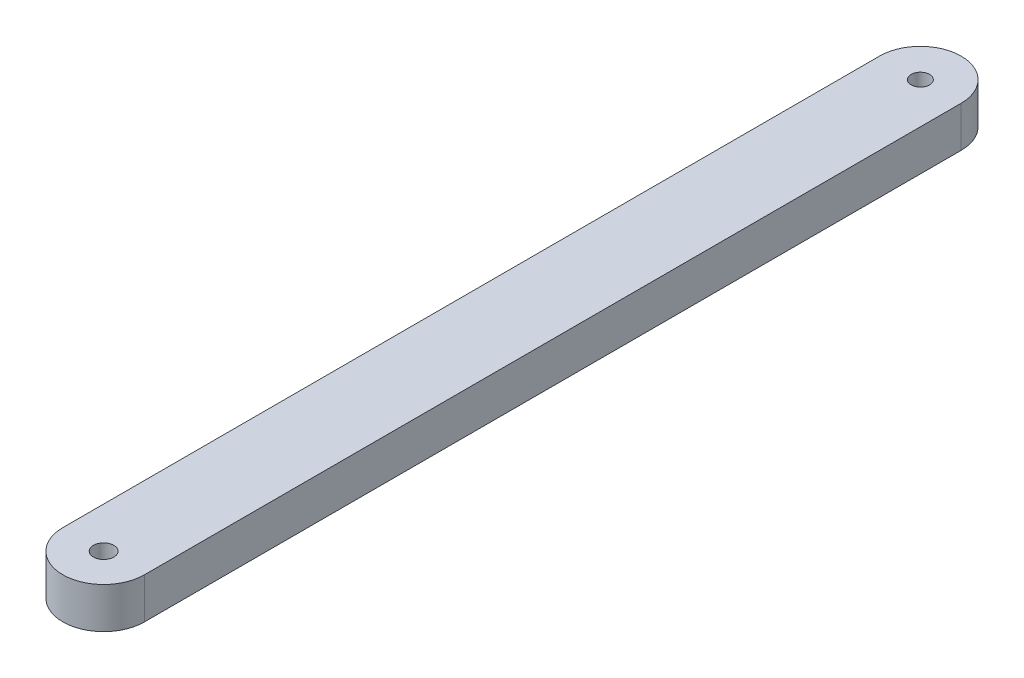
from build123d import *

# Parameters (mm, degrees)
SKETCH1_R           = 2.5
BOSS_EXTRUDE1_DEPTH = 10


with BuildPart() as part:
    # Sketch1 → Boss-Extrude1 (new body)
    with BuildSketch(Plane(origin=(0, 0, 0), x_dir=(1, 0, 0), z_dir=(0, 1, 0))):
        with BuildLine():
            ThreePointArc((-10, -100), (0, -110), (10, -100))
            Line((10, -100), (10, 100))
            ThreePointArc((10, 100), (0, 110), (-10, 100))
            Line((-10, 100), (-10, -100))
        make_face()
        with Locations((0, -100)):
            Circle(SKETCH1_R, mode=Mode.SUBTRACT)
        with BuildLine():
            ThreePointArc((1.5875, 98.4125), (0, 97.75493597), (-1.5875, 98.4125))
            ThreePointArc((-1.5875, 98.4125), (-2.24506403, 100), (-1.5875, 101.5875))
            ThreePointArc((-1.5875, 101.5875), (0, 102.24506403), (1.5875, 101.5875))
            ThreePointArc((1.5875, 101.5875), (2.074168707, 100.859148809), (2.24506403, 100))
            ThreePointArc((2.24506403, 100), (2.074168707, 99.140851191), (1.5875, 98.4125))
        make_face(mode=Mode.SUBTRACT)
    extrude(amount=BOSS_EXTRUDE1_DEPTH)


solid = part.part
